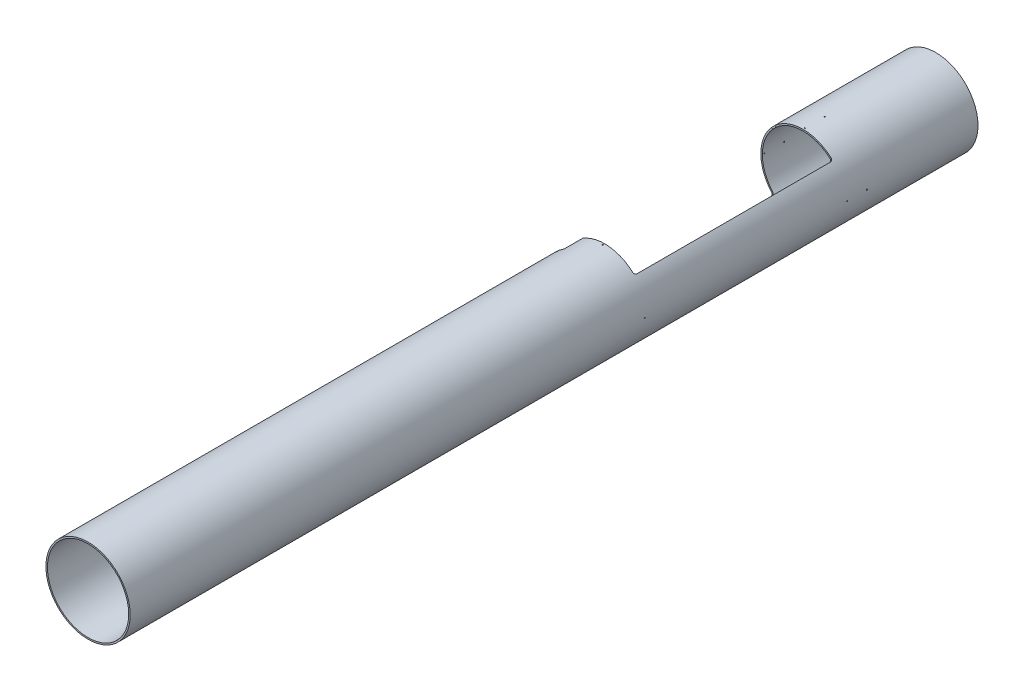
from build123d import *

# Parameters (mm, degrees)
SKETCH1_R           = 85
SKETCH1_R_2         = 82
BOSS_EXTRUDE1_DEPTH = 1710
SKETCH2_R           = 1
CUT_EXTRUDE2_DEPTH  = 90
CIRPATTERN1_COUNT   = 4
SKETCH4_W           = 170
SKETCH4_H           = 400
CUT_EXTRUDE4_DEPTH  = 516
CUT_EXTRUDE5_DEPTH  = 12
FILLET2_R           = 5
CUT_EXTRUDE6_DEPTH  = 26
SKETCH8_R           = 1
CUT_EXTRUDE7_DEPTH  = 246
CIRPATTERN2_COUNT   = 4
BOSS_EXTRUDE2_DEPTH = 60
FILLET3_R           = 10
SKETCH12_W          = 12
SKETCH12_H          = 20
SKETCH12_R          = 1.25
CUT_EXTRUDE8_DEPTH  = 101


with BuildPart() as part:
    # Sketch1 → Boss-Extrude1 (new body)
    with BuildSketch(Plane.XY):
        with Locations(Location((0, 0, 0), (0, 0, 180))):
            Circle(SKETCH1_R)
        with Locations(Location((0, 0, 0), (0, 0, 180))):
            Circle(SKETCH1_R_2, mode=Mode.SUBTRACT)
    extrude(amount=BOSS_EXTRUDE1_DEPTH)

    # Sketch2 → Cut-Extrude2 (cut)
    with BuildSketch(Plane(origin=(0, 0, 0), x_dir=(1, 0, 0), z_dir=(0, 1, 0))):
        with Locations(Location((0, -224, 0), (0, 0, 270))):
            Circle(SKETCH2_R)
        with Locations(Location((0, -264, 0), (0, 0, 270))):
            Circle(SKETCH2_R)
    cut_extrude2 = extrude(amount=-CUT_EXTRUDE2_DEPTH, mode=Mode.SUBTRACT)

    # CirPattern1: Cut-Extrude2 ×4 about axis
    cirpattern1_axis = Axis((0, 0, 0), (0, 0, 1))
    for i in range(1, CIRPATTERN1_COUNT):
        add(cut_extrude2.rotate(cirpattern1_axis, i * 360 / CIRPATTERN1_COUNT), mode=Mode.SUBTRACT)

    # Sketch4 → Cut-Extrude4 (cut)
    with BuildSketch(Plane(origin=(0, 0, 0), x_dir=(0.7071067811865477, 0.7071067811865475, 0), z_dir=(-0.7071067811865475, 0.7071067811865477, 0))):
        with Locations((0, -468)):
            Rectangle(SKETCH4_W, SKETCH4_H)
    extrude(amount=CUT_EXTRUDE4_DEPTH, mode=Mode.SUBTRACT)

    # Sketch5 → Cut-Extrude5 (cut)
    with BuildSketch(Plane.XY.offset(268)):
        Polygon((-64.528282489, 71.335925066), (-48.72922556, 56.061701815), (-55.679870313, 48.872227736), (-71.478927241, 64.146450987), align=None)
    extrude(amount=-CUT_EXTRUDE5_DEPTH, mode=Mode.SUBTRACT)

    # Fillet2
    fillet2_edges = [part.edges().sort_by_distance(p)[0] for p in [
        (-59.043416229, -59.043416229, 668),
        (59.043416229, 59.043416229, 668),
        (59.043416229, 59.043416229, 268),
        (-59.043416229, -59.043416229, 268),
    ]]
    fillet(fillet2_edges, radius=FILLET2_R)

    # Sketch6 → Cut-Extrude6 (cut)
    with BuildSketch(Plane(origin=(0, 0, 668), x_dir=(-1, 0, 0), z_dir=(0, 0, -1))):
        Polygon((83.989100868, 55.704829621), (64.503323181, 36.219051933), (36.219051933, 64.503323181), (55.704829621, 83.989100868), align=None)
    extrude(amount=-CUT_EXTRUDE6_DEPTH, mode=Mode.SUBTRACT)

    # Sketch8 → Cut-Extrude7 (cut)
    with BuildSketch(Plane(origin=(0, 0, 0), x_dir=(1, 0, 0), z_dir=(0, 1, 0))):
        with Locations(Location((0, -672, 0), (0, 0, 90))):
            Circle(SKETCH8_R)
    cut_extrude7 = extrude(amount=CUT_EXTRUDE7_DEPTH, mode=Mode.SUBTRACT)

    # CirPattern2: Cut-Extrude7 ×4 about axis
    cirpattern2_axis = Axis((0, 0, 668), (0, 0, -1))
    for i in range(1, CIRPATTERN2_COUNT):
        add(cut_extrude7.rotate(cirpattern2_axis, i * 360 / CIRPATTERN2_COUNT), mode=Mode.SUBTRACT)

    # Sketch10 → Boss-Extrude2 (add)
    with BuildSketch(Plane(origin=(0, 0, 694), x_dir=(-1, 0, 0), z_dir=(0, 0, -1))):
        with BuildLine():
            Line((40.321165446, 71.401705982), (71.401705982, 40.321165446))
            ThreePointArc((71.401705982, 40.321165446), (57.982756057, 57.982756057), (40.321165446, 71.401705982))
        make_face()
    extrude(amount=-BOSS_EXTRUDE2_DEPTH)

    # Fillet3
    # the kernel refuses this fillet: 10 mm, written as the material it takes off along each edge
    with BuildSketch(Plane(origin=(-22.643495916, 89.079375511, 754), x_dir=(0, 0, -1), z_dir=(-0.707106781186546, -0.707106781186549, 0))) as fillet3_piece_1_section:
        with BuildLine():
            CenterArc((FILLET3_R, -FILLET3_R), FILLET3_R, 90, 90)
            Line((0, -FILLET3_R), (0, 0))
            Line((0, 0), (FILLET3_R, 0))
        make_face()
    fillet3_piece_1 = extrude(amount=93.954521952, mode=Mode.PRIVATE)
    fillet3_piece_1 = fillet3_piece_1 & Plane(origin=(0, 0, 750.767328504), x_dir=(-1, 0, 0), z_dir=(0, 0, -1)) * Cylinder(82, 228, mode=Mode.PRIVATE)
    add(fillet3_piece_1, mode=Mode.SUBTRACT)

    # Sketch12 → Cut-Extrude8 (cut)
    with BuildSketch(Plane(origin=(-55.861435714, 55.861435714, 0), x_dir=(0, 0, -1), z_dir=(0.7071067811865489, -0.7071067811865462, 0))):
        with Locations((-700, -10)):
            Rectangle(SKETCH12_W, SKETCH12_H)
        with Locations((-700, 10)):
            Rectangle(SKETCH12_W, SKETCH12_H)
        with Locations(Location((-731, 0, 0), (0, 0, 90))):
            Circle(SKETCH12_R)
        with Locations(Location((-713, 10.392304845, 0), (0, 0, 90))):
            Circle(SKETCH12_R)
        with Locations(Location((-713, -10.392304845, 0), (0, 0, 90))):
            Circle(SKETCH12_R)
    extrude(amount=-CUT_EXTRUDE8_DEPTH, mode=Mode.SUBTRACT)


solid = part.part
